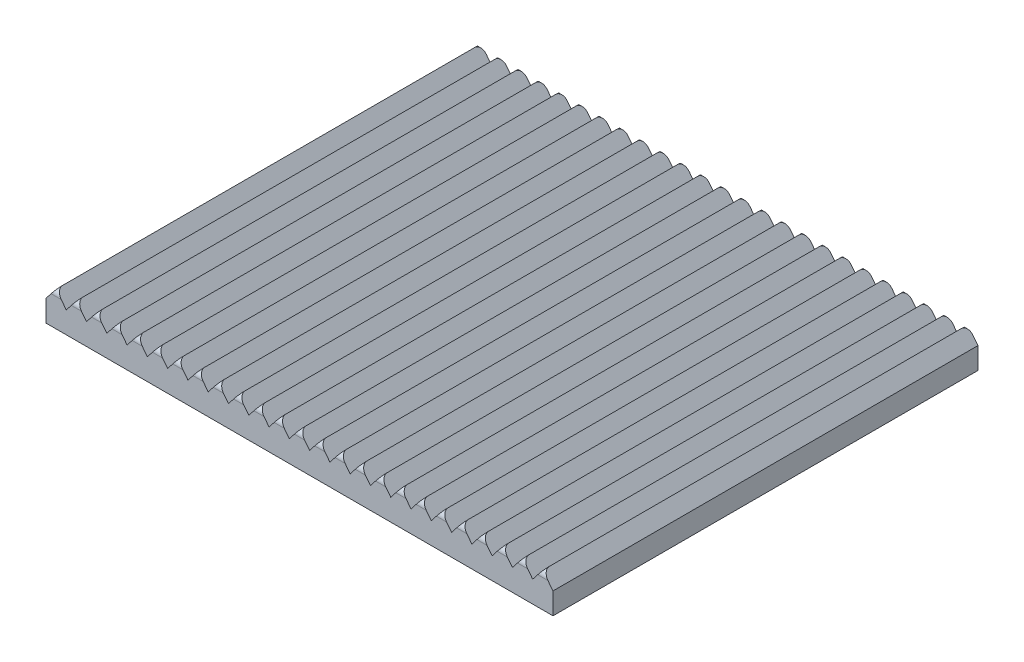
from build123d import *

# Parameters (mm, degrees)
SKETCH1_R           = 3.05
BOSS_EXTRUDE1_DEPTH = 1.5
BOSS_EXTRUDE2_DEPTH = 49.25
CUT_EXTRUDE1_DEPTH  = 1
CUT_EXTRUDE3_DEPTH  = 64.82752638948185
SKETCH5_R           = 3.099999999999995
BOSS_EXTRUDE3_DEPTH = 0.5
CUT_EXTRUDE4_DEPTH  = 0.5
CHAMFER3_SIZE       = 1.5


with BuildPart() as part:
    # Sketch1 → Boss-Extrude1 (new body)
    with BuildSketch(Plane(origin=(0, 0, 0), x_dir=(1, 0, 0), z_dir=(0, 1, 0))):
        Polygon((-29.375, 24.624999999999996), (29.375, 24.624999999999996), (29.375000000000004, -24.625000000000004), (-29.374999999999993, -24.625000000000004), align=None)
        with Locations(Location((-3.47e-15, -3.47e-15, 0), (0, 0, 270))):
            Circle(SKETCH1_R, mode=Mode.SUBTRACT)
    extrude(amount=BOSS_EXTRUDE1_DEPTH)

    # Sketch2 → Boss-Extrude2 (add)
    with BuildSketch(Plane(origin=(0, 0, -24.624999999999996), x_dir=(-1, 0, 0), z_dir=(0, 0, -1))):
        Polygon((-29.375, 1.5), (29.375, 1.5), (29.375, 2.5), (28.199999999999996, 4), (27.025, 2.5), (25.849999999999998, 4), (24.675, 2.5), (23.499999999999996, 4), (22.325, 2.5), (21.149999999999995, 4), (19.974999999999998, 2.5), (18.799999999999997, 4), (17.625, 2.5), (16.45, 4), (15.275, 2.5), (14.099999999999998, 4), (12.924999999999999, 2.5), (11.749999999999998, 4), (10.575, 2.5), (9.399999999999999, 4), (8.225, 2.5), (7.049999999999999, 4), (5.874999999999999, 2.5), (4.699999999999999, 4), (3.525, 2.5), (2.3499999999999996, 4), (1.1749999999999996, 2.5), (0, 4), (-1.1749999999999996, 2.5), (-2.3499999999999996, 4), (-3.525, 2.5), (-4.699999999999999, 4), (-5.874999999999999, 2.5), (-7.049999999999999, 4), (-8.225, 2.5), (-9.399999999999999, 4), (-10.575, 2.5), (-11.749999999999998, 4), (-12.924999999999999, 2.5), (-14.099999999999998, 4), (-15.275, 2.5), (-16.45, 4), (-17.625, 2.5), (-18.799999999999997, 4), (-19.974999999999998, 2.5), (-21.149999999999995, 4), (-22.325, 2.5), (-23.499999999999996, 4), (-24.675, 2.5), (-25.849999999999998, 4), (-27.025, 2.5), (-28.199999999999996, 4), (-29.375, 2.5), align=None)
    extrude(amount=-BOSS_EXTRUDE2_DEPTH)

    # Sketch3 → Cut-Extrude1 (cut)
    with BuildSketch(Plane(origin=(0, 0, 0), x_dir=(-1, 0, 0), z_dir=(0, -1, 0))):
        with BuildLine():
            Line((-1.7499999999999998, -2.497999199359359), (-1.7499999999999993, -5))
            Line((-1.7499999999999993, -5), (1.7500000000000007, -5))
            Line((1.7500000000000007, -5), (1.7499999999999998, -2.4979991993593593))
            ThreePointArc((1.7499999999999998, -2.4979991993593593), (1.54e-15, 3.05), (-1.7499999999999998, -2.497999199359359))
        make_face()
    extrude(amount=-CUT_EXTRUDE1_DEPTH, mode=Mode.SUBTRACT)

    # Sketch4 → Cut-Extrude3 (cut, through all)
    with BuildSketch(Plane(origin=(29.375000000000004, 0, -4.14e-15), x_dir=(-1.4e-16, 0, -1), z_dir=(1, 0, -1.4e-16))):
        with BuildLine():
            Line((-23.875000000000007, 4), (-24.625000000000007, 4))
            Line((-24.625000000000007, 4), (-24.625000000000007, 3.2500000000000004))
            ThreePointArc((-24.625000000000007, 3.2500000000000004), (-24.40533008588992, 3.7803300858899114), (-23.875000000000007, 4))
        make_face()
    cut_extrude3 = extrude(amount=-CUT_EXTRUDE3_DEPTH, mode=Mode.SUBTRACT)

    # Mirror1: Cut-Extrude3 across plane
    add(cut_extrude3.mirror(Plane.XY), mode=Mode.SUBTRACT)

    # Sketch5 → Boss-Extrude3 (add)
    with BuildSketch(Plane.XZ.offset(-1.5)):
        Circle(SKETCH5_R)
    extrude(amount=BOSS_EXTRUDE3_DEPTH)

    # Sketch6 → Cut-Extrude4 (cut)
    with BuildSketch(Plane.XZ.offset(-1)):
        Polygon((1.7499999999999993, 5), (-1.7499999999999998, 5), (-1.7500000000000027, 2.497999199359363), (1.7499999999999993, 2.497999199359363), align=None)
    extrude(amount=-CUT_EXTRUDE4_DEPTH, mode=Mode.SUBTRACT)

    # Chamfer3
    chamfer3_edges = [part.edges().sort_by_distance(p)[0] for p in [
        (-6.7e-16, 0, 5),
    ]]
    chamfer(chamfer3_edges, length=CHAMFER3_SIZE - 0.0001)  # a hair under: the kernel refuses the full size


solid = part.part
